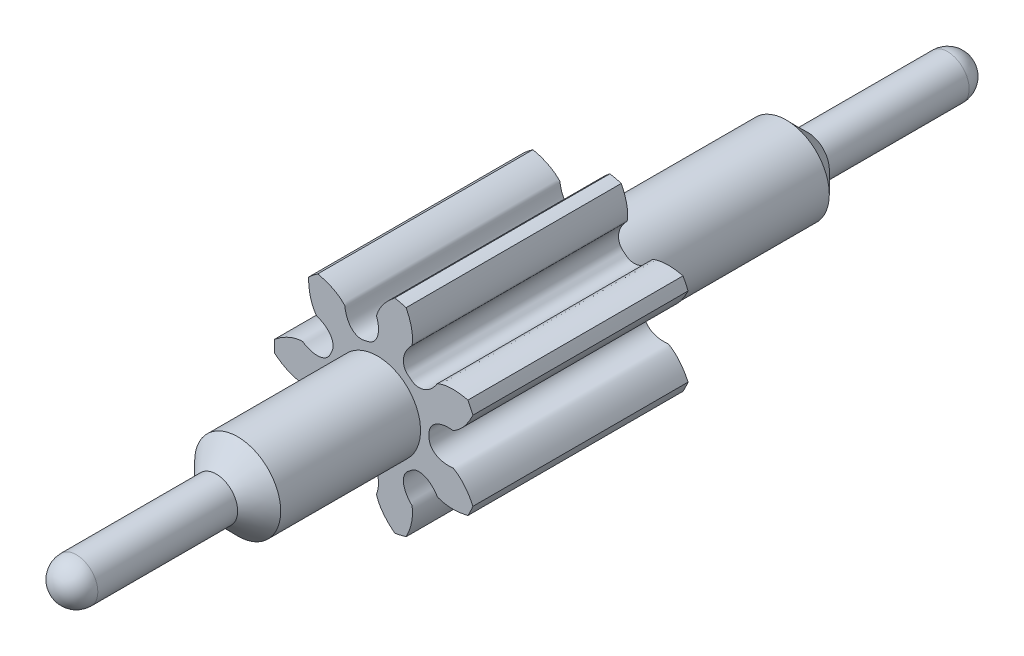
from build123d import *

# Parameters (mm, degrees)
SKETCHREVOLVEENGRANAJE_7D_W       = 1
SKETCHREVOLVEENGRANAJE_7D_H       = 0.48
TOOTHEXTRUDECUTENGRANAJE_7D_DEPTH = 0.5
PATTERNENGRANAJE_7D_COUNT         = 7
CROQUIS1_R                        = 0.2
SALIENTE_EXTRUIR1_DEPTH           = 0.75
CROQUIS2_R                        = 0.1
SALIENTE_EXTRUIR2_DEPTH           = 0.65
SALIENTE_EXTRUIR3_START           = 1
CROQUIS3_R                        = 0.2
SALIENTE_EXTRUIR3_DEPTH           = 1
SALIENTE_EXTRUIR4_START           = 0.65
CROQUIS4_R                        = 0.1
SALIENTE_EXTRUIR4_DEPTH           = 0.65
C_PULA1_FACE_RADIUS               = 0.1
C_PULA1_HEIGHT                    = 0.1
CHAFL_N1_SIZE                     = 0.1


# Read off the part's stored shape, not the designer's step: Cúpula2
with BuildPart() as part:
    # SketchRevolveEngranaje 7d → Engranaje 7d (revolve)
    with BuildSketch(Plane(origin=(0, 0, 0), x_dir=(0, 0, -1), z_dir=(1, 0, 0)), mode=Mode.PRIVATE) as engranaje_7d_sk:
        with Locations((0, 0.24)):
            Rectangle(SKETCHREVOLVEENGRANAJE_7D_W, SKETCHREVOLVEENGRANAJE_7D_H)
    revolve(engranaje_7d_sk.sketch.rotate(Axis((0, 0, 0), (0, 0, -1)), 90), axis=Axis((0, 0, 0), (0, 0, -1)))

    # SketchToothEngranaje 7d → ToothExtrudeCutEngranaje 7d (cut, symmetric)
    with BuildSketch(Plane.XY):
        with BuildLine():
            ThreePointArc((0.446533558, 0.190147905), (0.485333333, 0), (0.446533558, -0.190147905))
            add(Edge.make_bspline(
                [(0.446533558, -0.190147905), (0.440682164, -0.17652112), (0.431929858, -0.15933289), (0.419275122, -0.13967177), (0.412058075, -0.129555228), (0.404862657, -0.120424241), (0.397765397, -0.112252635), (0.390840466, -0.105007559), (0.384158487, -0.098656578), (0.377789185, -0.093145515), (0.371791555, -0.088471302), (0.366244231, -0.084449348), (0.359189679, -0.080293872), (0.352027626, -0.07418921), (0.343776374, -0.076381056), (0.33817405, -0.07652981), (0.333313065, -0.076735001), (0.328538133, -0.076731999), (0.323840086, -0.076596748), (0.319224094, -0.076311124), (0.314691463, -0.075881365), (0.31024441, -0.075307066), (0.305884842, -0.074589241), (0.301614705, -0.073728169), (0.29743594, -0.0727239), (0.293350553, -0.071576072), (0.289360668, -0.070283899), (0.285468606, -0.068846121), (0.281676985, -0.067260968), (0.27798884, -0.065526131), (0.274407765, -0.063638745), (0.270938094, -0.061595403), (0.267585108, -0.059392198), (0.264355266, -0.057024821), (0.261256472, -0.054488722), (0.258298347, -0.051779357), (0.2554925, -0.04889254), (0.252852759, -0.045824926), (0.250395322, -0.042574619), (0.248138777, -0.039141911), (0.246103928, -0.03553012), (0.24431328, -0.03174647), (0.242790568, -0.027802902), (0.241558562, -0.023716735), (0.240641903, -0.019510826), (0.240049697, -0.015213919), (0.239863, -0.011446386), (0.239838796, -0.006371438), (0.240122467, 0), (0.239838796, 0.006371438), (0.239863, 0.011446386), (0.240049697, 0.015213919), (0.240641903, 0.019510826), (0.241558562, 0.023716735), (0.242790568, 0.027802902), (0.24431328, 0.03174647), (0.246103928, 0.03553012), (0.248138777, 0.039141911), (0.250395322, 0.042574619), (0.252852759, 0.045824926), (0.2554925, 0.04889254), (0.258298347, 0.051779357), (0.261256472, 0.054488722), (0.264355266, 0.057024821), (0.267585108, 0.059392198), (0.270938094, 0.061595403), (0.274407765, 0.063638745), (0.27798884, 0.065526131), (0.281676985, 0.067260968), (0.285468606, 0.068846121), (0.289360668, 0.070283899), (0.293350553, 0.071576072), (0.29743594, 0.0727239), (0.301614705, 0.073728169), (0.305884842, 0.074589241), (0.31024441, 0.075307066), (0.314691463, 0.075881365), (0.319224094, 0.076311124), (0.323840086, 0.076596748), (0.328538133, 0.076731999), (0.333313065, 0.076735001), (0.33817405, 0.07652981), (0.343776374, 0.076381056), (0.352027626, 0.07418921), (0.359189679, 0.080293872), (0.366244231, 0.084449348), (0.371791555, 0.088471302), (0.377789185, 0.093145515), (0.384158487, 0.098656578), (0.390840466, 0.105007559), (0.397765397, 0.112252635), (0.404862657, 0.120424241), (0.412058075, 0.129555228), (0.419275122, 0.13967177), (0.431929858, 0.15933289), (0.440682164, 0.17652112), (0.446533558, 0.190147905)],
                knots=[0, 0, 0, 0, 0.072272817, 0.093763527, 0.11395177, 0.132837546, 0.150420855, 0.166701697, 0.181680071, 0.195355978, 0.207729418, 0.218800391, 0.228568897, 0.248301688, 0.259906194, 0.267929088, 0.275819095, 0.283579683, 0.291214621, 0.298728, 0.30612427, 0.313408271, 0.320585264, 0.327660969, 0.334641606, 0.341533924, 0.348345241, 0.355083477, 0.361757175, 0.36837552, 0.374948338, 0.381486075, 0.387999748, 0.394500855, 0.401001241, 0.407512899, 0.414047705, 0.420617072, 0.427231528, 0.433900219, 0.440630368, 0.447426718, 0.454291025, 0.461221684, 0.468213541, 0.475257999, 0.482343433, 0.486586302, 0.5, 0.513413698, 0.517656567, 0.524742001, 0.531786459, 0.538778316, 0.545708975, 0.552573282, 0.559369632, 0.566099781, 0.572768472, 0.579382928, 0.585952295, 0.592487101, 0.598998759, 0.605499145, 0.612000252, 0.618513925, 0.625051662, 0.63162448, 0.638242825, 0.644916523, 0.651654759, 0.658466076, 0.665358394, 0.672339031, 0.679414736, 0.686591729, 0.69387573, 0.701272, 0.708785379, 0.716420317, 0.724180905, 0.732070912, 0.740093806, 0.751698312, 0.771431103, 0.781199609, 0.792270582, 0.804644022, 0.818319929, 0.833298303, 0.849579145, 0.867162454, 0.88604823, 0.906236473, 0.927727183, 1, 1, 1, 1], degree=3))
        make_face()
    toothextrudecutengranaje_7d = extrude(amount=TOOTHEXTRUDECUTENGRANAJE_7D_DEPTH, both=True, mode=Mode.SUBTRACT)

    # PatternEngranaje 7d: ToothExtrudeCutEngranaje 7d ×7 about axis
    patternengranaje_7d_axis = Axis((0, 0, 55), (0, 0, -1))
    for i in range(1, PATTERNENGRANAJE_7D_COUNT):
        add(toothextrudecutengranaje_7d.rotate(patternengranaje_7d_axis, i * 360 / PATTERNENGRANAJE_7D_COUNT), mode=Mode.SUBTRACT)

    # Croquis1 → Saliente-Extruir1 (add)
    with BuildSketch(Plane.XY.offset(0.5)):
        with Locations(Location((0, 0, 0), (0, 0, 180))):
            Circle(CROQUIS1_R)
    extrude(amount=SALIENTE_EXTRUIR1_DEPTH)

    # Croquis2 → Saliente-Extruir2 (add)
    with BuildSketch(Plane.XY.offset(1.25)):
        Circle(CROQUIS2_R)
    extrude(amount=SALIENTE_EXTRUIR2_DEPTH)

    # Croquis3 → Saliente-Extruir3 (add)
    with BuildSketch(Plane(origin=(0, 0, -0.5), x_dir=(-1, 0, 0), z_dir=(0, 0, -1)).offset(SALIENTE_EXTRUIR3_START)):
        Circle(CROQUIS3_R)
    extrude(amount=-SALIENTE_EXTRUIR3_DEPTH)

    # Croquis4 → Saliente-Extruir4 (add)
    with BuildSketch(Plane(origin=(0, 0, -1.5), x_dir=(-1, 0, 0), z_dir=(0, 0, -1)).offset(SALIENTE_EXTRUIR4_START)):
        with Locations(Location((0, 0, 0), (0, 0, 180))):
            Circle(CROQUIS4_R)
    extrude(amount=-SALIENTE_EXTRUIR4_DEPTH)

    # Cúpula1: an elliptical dome of height H over a round flat face of radius A is half a spheroid: the quarter ellipse of half axes A and H revolved about the face's axis
    with BuildSketch(Plane((0, 0, -2.15), x_dir=(0, -1, 0), z_dir=(1, 0, 0)), mode=Mode.PRIVATE) as c_pula1_quarter:
        Ellipse(C_PULA1_FACE_RADIUS, C_PULA1_HEIGHT)
        Rectangle(C_PULA1_FACE_RADIUS, C_PULA1_HEIGHT, align=(Align.MIN, Align.MIN), mode=Mode.INTERSECT)
    revolve(c_pula1_quarter.sketch, axis=Axis((0, 0, -2.15), (0, 0, -1)))

    # Cúpula2 outline → Cúpula2 (revolve)
    with BuildSketch(Plane.XZ):
        with BuildLine():
            Line((0, 1.9), (0.1, 1.9))
            ThreePointArc((0.1, 1.9), (0.070710678, 1.970710678), (0, 2))
            Line((0, 2), (0, 1.9))
        make_face()
    revolve(axis=Axis((0, 0, 0), (0, 0, 1)))

    # Chaflán1
    chafl_n1_edges = [part.edges().sort_by_distance(p)[0] for p in [
        (0.2, 0, 1.25),
        (0.2, 0, -1.5),
    ]]
    chamfer(chafl_n1_edges, length=CHAFL_N1_SIZE - 0.0001)  # a hair under: the kernel refuses the full size


solid = part.part
